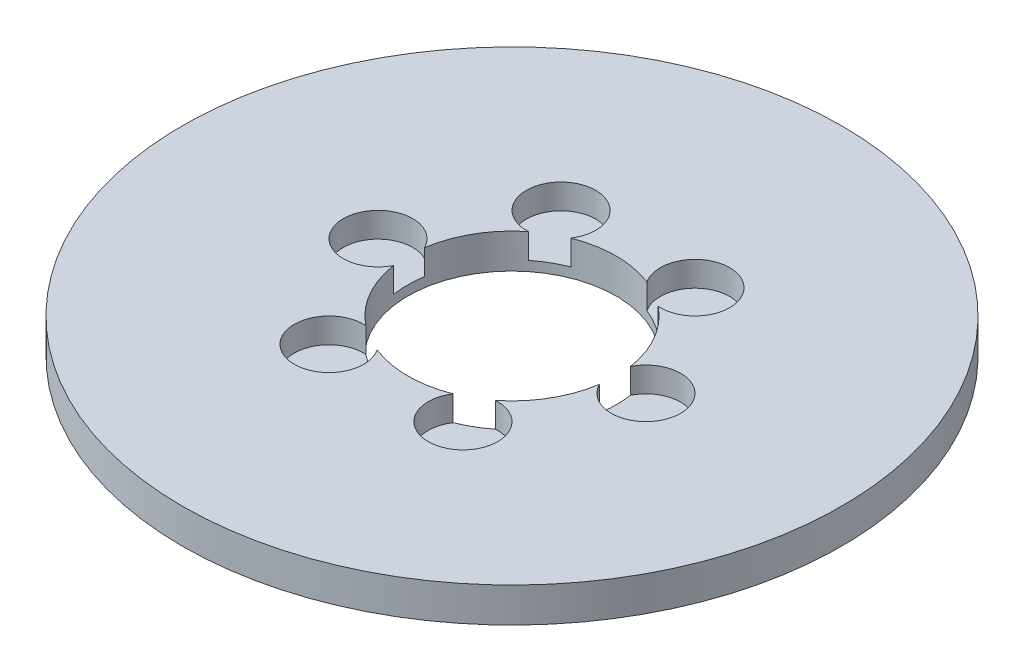
from build123d import *

# Parameters (mm, degrees)
SKETCH1_R           = 95
BOSS_EXTRUDE1_DEPTH = 10
SKETCH2_R           = 30
CUT_EXTRUDE1_DEPTH  = 135.721935853
SKETCH3_R           = 10
CUT_EXTRUDE2_DEPTH  = 7.195650119
CIRPATTERN1_COUNT   = 6


with BuildPart() as part:
    # Sketch1 → Boss-Extrude1 (new body)
    with BuildSketch(Plane(origin=(0, 0, 0), x_dir=(1, 0, 0), z_dir=(0, 1, 0))):
        Circle(SKETCH1_R)
    extrude(amount=BOSS_EXTRUDE1_DEPTH)

    # Sketch2 → Cut-Extrude1 (cut, through all)
    with BuildSketch(Plane(origin=(0, 0, 0), x_dir=(1, 0, 0), z_dir=(0, 1, 0))):
        Circle(SKETCH2_R)
    extrude(amount=CUT_EXTRUDE1_DEPTH, mode=Mode.SUBTRACT)

    # Sketch3 → Cut-Extrude2 (cut)
    with BuildSketch(Plane(origin=(0, 10, 0), x_dir=(1, 0, 0), z_dir=(0, 1, 0))):
        with Locations((-38.617028023, 0)):
            Circle(SKETCH3_R)
    cut_extrude2 = extrude(amount=-CUT_EXTRUDE2_DEPTH, mode=Mode.SUBTRACT)

    # CirPattern1: Cut-Extrude2 ×6 about axis
    cirpattern1_axis = Axis((0, 0, 0), (0, 1, 0))
    for i in range(1, CIRPATTERN1_COUNT):
        add(cut_extrude2.rotate(cirpattern1_axis, i * 360 / CIRPATTERN1_COUNT), mode=Mode.SUBTRACT)


solid = part.part
